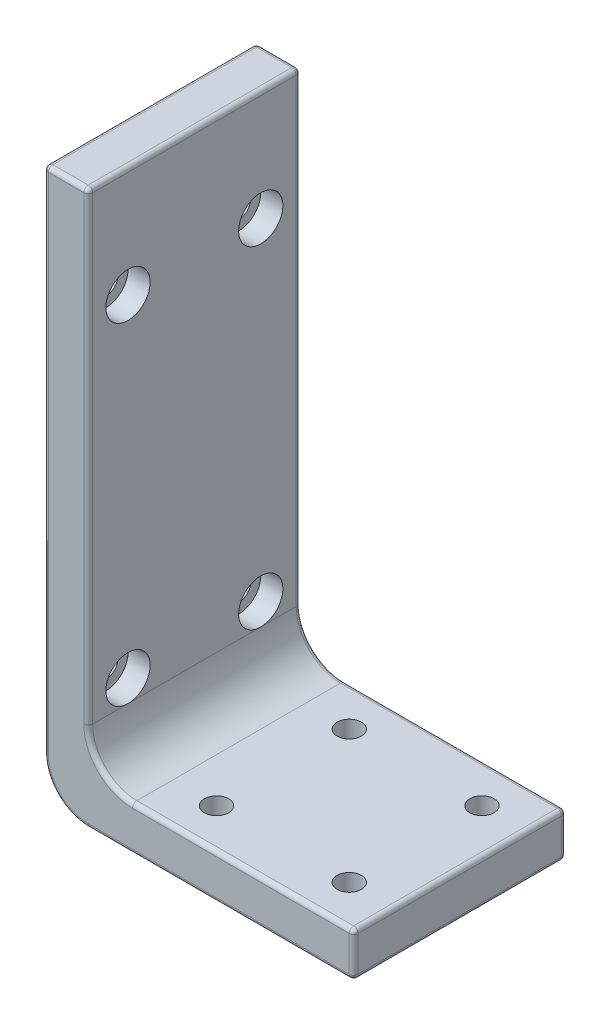
from build123d import *

# Parameters (mm, degrees)
BASE_DEPTH                           = 48
ROOT_EDGE_FILLET_R                   = 10
SLIDER_BOLT_HOLE_PATTERN_D           = 5.5
SLIDER_BOLT_HOLE_PATTERN_CBORE_D     = 10
SLIDER_BOLT_HOLE_PATTERN_CBORE_DEPTH = 5
DESKTOP_BOLT_HOLE_PATTERN_D          = 5.5
EXTERNAL_FILLET_R                    = 1


with BuildPart() as part:
    # Sketch1 → base (new body)
    with BuildSketch(Plane.XY):
        Polygon((0, 125), (0, 0), (70, 0), (70, 10), (10, 10), (10, 125), align=None)
    extrude(amount=BASE_DEPTH)

    # root_edge_fillet
    root_edge_fillet_edges = [part.edges().sort_by_distance(p)[0] for p in [
        (0, 0, 24),
        (10, 10, 24),
    ]]
    fillet(root_edge_fillet_edges, radius=ROOT_EDGE_FILLET_R)

    # slider_bolt_hole_pattern (through all)
    with Locations(Plane(origin=(10, 0, 0), x_dir=(0, 0, -1), z_dir=(1, 0, 0))):
        with Locations((-39, 100), (-9, 25), (-39, 25), (-9, 100)):
            CounterBoreHole(SLIDER_BOLT_HOLE_PATTERN_D / 2, SLIDER_BOLT_HOLE_PATTERN_CBORE_D / 2, SLIDER_BOLT_HOLE_PATTERN_CBORE_DEPTH)

    # desktop_bolt_hole_pattern (through all)
    with Locations(Plane(origin=(0, 10, 0), x_dir=(1, 0, 0), z_dir=(0, 1, 0))):
        with Locations((30, -9), (60, -39), (30, -39), (60, -9)):
            Hole(DESKTOP_BOLT_HOLE_PATTERN_D / 2)

    # external_fillet
    external_fillet_edges = [part.edges().sort_by_distance(p)[0] for p in [
        (10, 125, 24),
        (0, 125, 24),
        (70, 0, 24),
        (70, 10, 24),
        (70, 5, 0),
        (45, 10, 0),
        (12.928932188, 12.928932188, 0),
        (10, 72.5, 0),
        (5, 125, 0),
        (0, 67.5, 0),
        (2.928932188, 2.928932188, 0),
        (40, 0, 0),
        (5, 125, 48),
        (10, 72.5, 48),
        (12.928932188, 12.928932188, 48),
        (45, 10, 48),
        (70, 5, 48),
        (40, 0, 48),
        (2.928932188, 2.928932188, 48),
        (0, 67.5, 48),
    ]]
    fillet(external_fillet_edges, radius=EXTERNAL_FILLET_R)


solid = part.part
